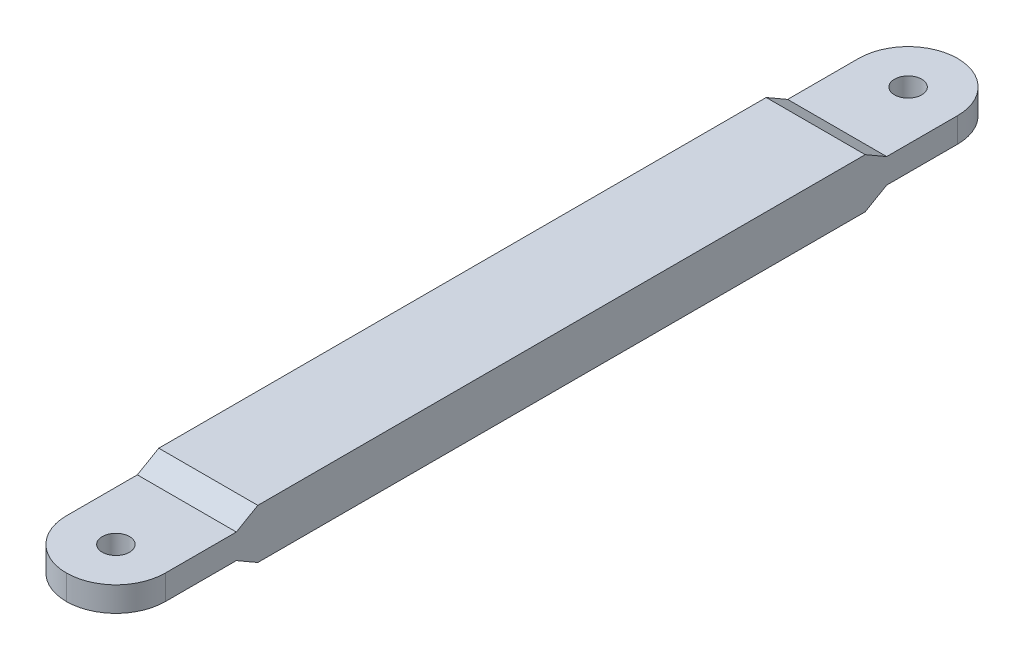
from build123d import *

# Parameters (mm, degrees)
BOSS_EXTRUDE1_DEPTH      = 70
BOSS_EXTRUDE1_DEPTH_BACK = 70
SKETCH1_W                = 20
SKETCH1_H                = 10
SKETCH3_W                = 20
SKETCH3_H                = 5
BOSS_EXTRUDE2_DEPTH      = 20
FILLET1_R                = 10
SKETCH4_R                = 2.75
CUT_EXTRUDE1_DEPTH       = 91.863909227
FILLET1_OF_MIRROR1_R     = 10
CHAMFER1_SIZE            = 8.660254038
CHAMFER1_SIZE_2          = 5


# Some blends are built 0.0001 mm under size
with BuildPart() as part:
    # Sketch1 → Boss-Extrude1 (new, two sides: drawn at the far end of the back side and taken through both)
    with BuildSketch(Plane.XY.offset(-BOSS_EXTRUDE1_DEPTH_BACK)):
        Rectangle(SKETCH1_W, SKETCH1_H)
    extrude(amount=BOSS_EXTRUDE1_DEPTH + BOSS_EXTRUDE1_DEPTH_BACK)

    # Sketch3 → Boss-Extrude2 (add)
    with BuildSketch(Plane(origin=(0, 0, -70), x_dir=(-1, 0, 0), z_dir=(0, 0, -1))):
        Rectangle(SKETCH3_W, SKETCH3_H)
    boss_extrude2 = extrude(amount=BOSS_EXTRUDE2_DEPTH)

    # Fillet1
    fillet1_edges = [part.edges().sort_by_distance(p)[0] for p in [
        (-10, 0, -90),
        (10, 0, -90),
    ]]
    fillet(fillet1_edges, radius=FILLET1_R - 0.0001)  # a hair under: the kernel refuses the full size

    # Sketch4 → Cut-Extrude1 (cut, through all)
    with BuildSketch(Plane(origin=(0, 2.5, 0), x_dir=(1, 0, 0), z_dir=(0, 1, 0))):
        with Locations(Location((0, 80, 0), (0, 0, 270))):
            Circle(SKETCH4_R)
    cut_extrude1 = extrude(amount=-CUT_EXTRUDE1_DEPTH, mode=Mode.SUBTRACT)

    # Mirror1: Boss-Extrude2, Cut-Extrude1 across plane
    add(boss_extrude2.mirror(Plane.XY))
    add(cut_extrude1.mirror(Plane.XY), mode=Mode.SUBTRACT)

    # Fillet1 of Mirror1
    fillet1_of_mirror1_edges = [part.edges().sort_by_distance(p)[0] for p in [
        (-10, 0, 90),
        (10, 0, 90),
    ]]
    fillet(fillet1_of_mirror1_edges, radius=FILLET1_OF_MIRROR1_R - 0.0001)  # a hair under: the kernel refuses the full size

    # Chamfer1
    # the kernel refuses this chamfer: 8.660254038, 5 mm, written as the material it takes off along each edge
    with BuildSketch(Plane(origin=(32.404819853, 5, -70), x_dir=(0, 0.019326765612700594, 0.999813220622208), z_dir=(-1, 0, 0))) as chamfer1_piece_1_section:
        Polygon((CHAMFER1_SIZE * 0.999813220604, -CHAMFER1_SIZE * 0.0193267656124), (-CHAMFER1_SIZE_2 * 0.0193267656127, -CHAMFER1_SIZE_2 * 0.999813220622), (0, 0), align=None)
    chamfer1_piece_1 = extrude(amount=64.809639706, mode=Mode.PRIVATE)
    chamfer1_piece_1 = split(chamfer1_piece_1, bisect_by=Plane(origin=(0, 2.5, -66.539331058), z_dir=(0, 1, 0)), keep=Keep.TOP, mode=Mode.PRIVATE)
    add(chamfer1_piece_1, mode=Mode.SUBTRACT)
    with BuildSketch(Plane(origin=(-32.404819853, -5, -70), x_dir=(0, -0.019326765612700594, 0.999813220622208), z_dir=(1, 0, 0))) as chamfer1_piece_2_section:
        Polygon((CHAMFER1_SIZE * 0.999813220604, -CHAMFER1_SIZE * 0.0193267656124), (-CHAMFER1_SIZE_2 * 0.0193267656127, -CHAMFER1_SIZE_2 * 0.999813220622), (0, 0), align=None)
    chamfer1_piece_2 = extrude(amount=64.809639706, mode=Mode.PRIVATE)
    chamfer1_piece_2 = split(chamfer1_piece_2, bisect_by=Plane(origin=(0, -2.5, -66.539331058), z_dir=(0, -1, 0)), keep=Keep.TOP, mode=Mode.PRIVATE)
    add(chamfer1_piece_2, mode=Mode.SUBTRACT)
    with BuildSketch(Plane(origin=(-32.404819853, -5, 70), x_dir=(0, 0.9983227437537926, 0.05789386240267045), z_dir=(1, 0, 0))) as chamfer1_piece_3_section:
        Polygon((CHAMFER1_SIZE_2 * 0.998322743754, -CHAMFER1_SIZE_2 * 0.0578938624027), (-CHAMFER1_SIZE * 0.0578938624016, -CHAMFER1_SIZE * 0.998322743736), (0, 0), align=None)
    chamfer1_piece_3 = extrude(amount=64.809639706, mode=Mode.PRIVATE)
    chamfer1_piece_3 = split(chamfer1_piece_3, bisect_by=Plane(origin=(0, -2.5, 66.539331058), z_dir=(0, -1, 0)), keep=Keep.TOP, mode=Mode.PRIVATE)
    add(chamfer1_piece_3, mode=Mode.SUBTRACT)
    with BuildSketch(Plane(origin=(32.404819853, 5, 70), x_dir=(0, -0.9983227437537926, 0.05789386240267045), z_dir=(-1, 0, 0))) as chamfer1_piece_4_section:
        Polygon((CHAMFER1_SIZE_2 * 0.998322743754, -CHAMFER1_SIZE_2 * 0.0578938624027), (-CHAMFER1_SIZE * 0.0578938624016, -CHAMFER1_SIZE * 0.998322743736), (0, 0), align=None)
    chamfer1_piece_4 = extrude(amount=64.809639706, mode=Mode.PRIVATE)
    chamfer1_piece_4 = split(chamfer1_piece_4, bisect_by=Plane(origin=(0, 2.5, 66.539331058), z_dir=(0, 1, 0)), keep=Keep.TOP, mode=Mode.PRIVATE)
    add(chamfer1_piece_4, mode=Mode.SUBTRACT)


solid = part.part
